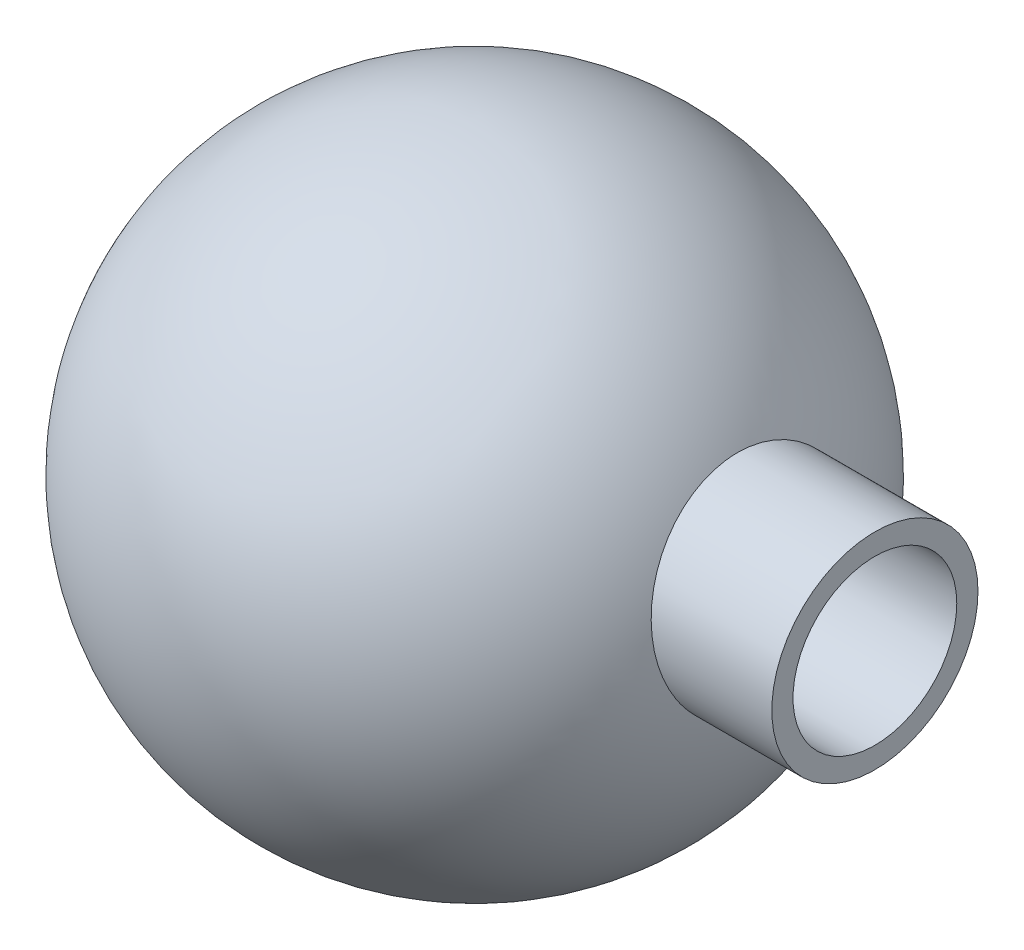
from build123d import *

# Parameters (mm, degrees)
SKETCH2_R                       = 21.59
SKETCH2_R_2                     = 17.145
BOSS_EXTRUDE1_DEPTH             = 83.82
BOSS_EXTRUDE1_DIRECTION_2_REACH = 111.985
SKETCH2_4_R                     = 17.145
CUT_EXTRUDE3_DEPTH              = 138.938


with BuildPart() as part:
    # Sketch1 → Revolve1 (revolve)
    with BuildSketch(Plane.XY):
        with BuildLine():
            Line((-63.5, 0), (-60.96, 0))
            ThreePointArc((-60.96, 0), (0, 60.96), (60.96, 0))
            Line((60.96, 0), (63.5, 0))
            ThreePointArc((63.5, 0), (0, 63.5), (-63.5, 0))
        make_face()
    revolve(axis=Axis((-63.5, 0, 0), (1, 0, 0)))

    # Sketch2 → Boss-Extrude1 (add)
    with BuildSketch(Plane(origin=(0, 0, 0), x_dir=(0, 0, -1), z_dir=(1, 0, 0))):
        with Locations((0, 10.0076)):
            Circle(SKETCH2_R)
        with Locations((0, 10.0076)):
            Circle(SKETCH2_R_2, mode=Mode.SUBTRACT)
    extrude(amount=BOSS_EXTRUDE1_DEPTH)

    # Sketch2 → Boss-Extrude1 direction 2 (add, up to next)
    with BuildSketch(Plane(origin=(0, 0, 0), x_dir=(0, 0, -1), z_dir=(1, 0, 0)), mode=Mode.PRIVATE) as boss_extrude1_direction_2_sk1:
        with Locations((0, 10.0076)):
            Circle(SKETCH2_R)
        with Locations((0, 10.0076)):
            Circle(SKETCH2_R_2, mode=Mode.SUBTRACT)
    boss_extrude1_direction_2_tool1 = extrude(boss_extrude1_direction_2_sk1.sketch, amount=-BOSS_EXTRUDE1_DIRECTION_2_REACH, mode=Mode.PRIVATE) - part.part
    add(boss_extrude1_direction_2_tool1.solids().sort_by_distance((0, 10.0076, 20.979343))[0])

    # Sketch2<4> → Cut-Extrude3 (cut)
    with BuildSketch(Plane(origin=(0, 0, 0), x_dir=(0, 0, -1), z_dir=(1, 0, 0))):
        with Locations((0, 10.0076)):
            Circle(SKETCH2_4_R)
    extrude(amount=CUT_EXTRUDE3_DEPTH, mode=Mode.SUBTRACT)


solid = part.part
